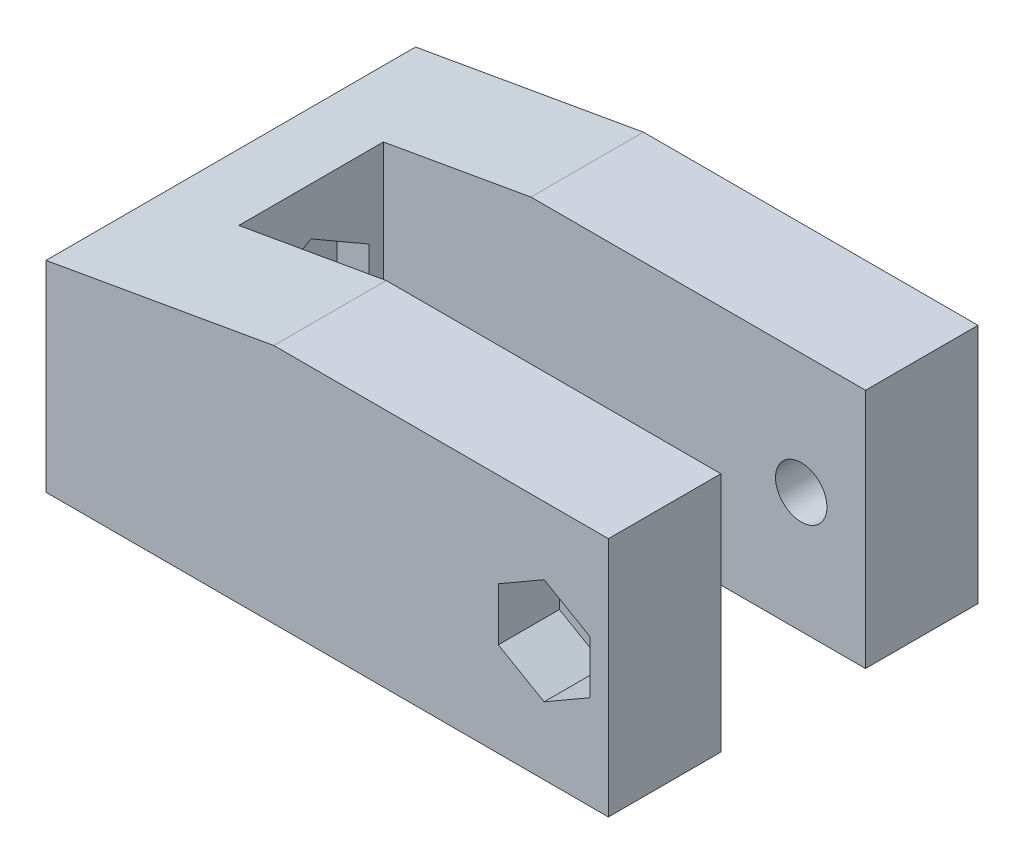
from build123d import *

# Parameters (mm, degrees)
SKETCH1_W               = 23
SKETCH1_H               = 15
BOSS_EXTRUDE1_DEPTH     = 35
SKETCH2_W               = 9
SKETCH2_H               = 15
CUT_EXTRUDE1_DEPTH      = 30
CUT_EXTRUDE2_DEPTH      = 45.485952839
CUT_EXTRUDE2_DEPTH_BACK = 45.485952839
SKETCH3_R               = 1.6
CHAMFER1_SIZE           = 2.5
CHAMFER1_SIZE_2         = 14.178204549
SKETCH4_R               = 2.2
CUT_EXTRUDE3_DEPTH      = 10
CUT_EXTRUDE4_DEPTH      = 2
SKETCH6_R               = 3.25
CUT_EXTRUDE5_DEPTH      = 2.5
CUT_EXTRUDE6_DEPTH      = 3.8


with BuildPart() as part:
    # Sketch1 → Boss-Extrude1 (new body)
    with BuildSketch(Plane(origin=(0, 0, 0), x_dir=(0, 0, -1), z_dir=(1, 0, 0))):
        with Locations((11.5, 7.5)):
            Rectangle(SKETCH1_W, SKETCH1_H)
    extrude(amount=BOSS_EXTRUDE1_DEPTH)

    # Sketch2 → Cut-Extrude1 (cut)
    with BuildSketch(Plane(origin=(35, 0, 0), x_dir=(0, 0, -1), z_dir=(1, 0, 0))):
        with Locations((11.5, 7.5)):
            Rectangle(SKETCH2_W, SKETCH2_H)
    extrude(amount=-CUT_EXTRUDE1_DEPTH, mode=Mode.SUBTRACT)

    # Sketch3 → Cut-Extrude2 (cut, two sides: drawn at the far end of the back side and taken through both)
    with BuildSketch(Plane(origin=(0, 0, -23), x_dir=(-1, 0, 0), z_dir=(0, 0, -1)).offset(-CUT_EXTRUDE2_DEPTH_BACK)):
        with Locations(Location((-31, 7.5, 0), (0, 0, 90))):
            Circle(SKETCH3_R)
    extrude(amount=CUT_EXTRUDE2_DEPTH + CUT_EXTRUDE2_DEPTH_BACK, mode=Mode.SUBTRACT)

    # Chamfer1
    # the kernel refuses this chamfer: 14.178204549, 2.5 mm, written as the material it takes off along each edge
    with BuildSketch(Plane(origin=(0, 15, -59.842614584), x_dir=(-0.21013876076743537, -0.9776715712462578, 0), z_dir=(0, 0, 1))) as chamfer1_piece_1:
        Polygon((CHAMFER1_SIZE * 0.977671571246, CHAMFER1_SIZE * 0.210138760767), (-CHAMFER1_SIZE_2 * 0.210138760768, CHAMFER1_SIZE_2 * 0.977671571249), (0, 0), align=None)
    extrude(amount=96.685229169, mode=Mode.SUBTRACT)

    # Sketch4 → Cut-Extrude3 (cut)
    with BuildSketch(Plane.ZY):
        with Locations((-11.5, 6.25)):
            Circle(SKETCH4_R)
    extrude(amount=-CUT_EXTRUDE3_DEPTH, mode=Mode.SUBTRACT)

    # Sketch5 → Cut-Extrude4 (cut)
    with BuildSketch(Plane(origin=(5, 0, 0), x_dir=(0, 0, -1), z_dir=(1, 0, 0))):
        Polygon((7.9, 8.328460969), (7.9, 4.171539031), (11.5, 2.093078062), (15.1, 4.171539031), (15.1, 8.328460969), (11.5, 10.406921938), align=None)
    extrude(amount=-CUT_EXTRUDE4_DEPTH, mode=Mode.SUBTRACT)

    # Sketch6 → Cut-Extrude5 (cut)
    with BuildSketch(Plane(origin=(0, 0, -23), x_dir=(-1, 0, 0), z_dir=(0, 0, -1))):
        with Locations((-31, 7.5)):
            Circle(SKETCH6_R)
    extrude(amount=-CUT_EXTRUDE5_DEPTH, mode=Mode.SUBTRACT)

    # Sketch7 → Cut-Extrude6 (cut)
    with BuildSketch(Plane.XY):
        Polygon((28.15, 9.145448267), (28.15, 5.854551733), (31, 4.209103466), (33.85, 5.854551733), (33.85, 9.145448267), (31, 10.790896534), align=None)
    extrude(amount=-CUT_EXTRUDE6_DEPTH, mode=Mode.SUBTRACT)


solid = part.part
